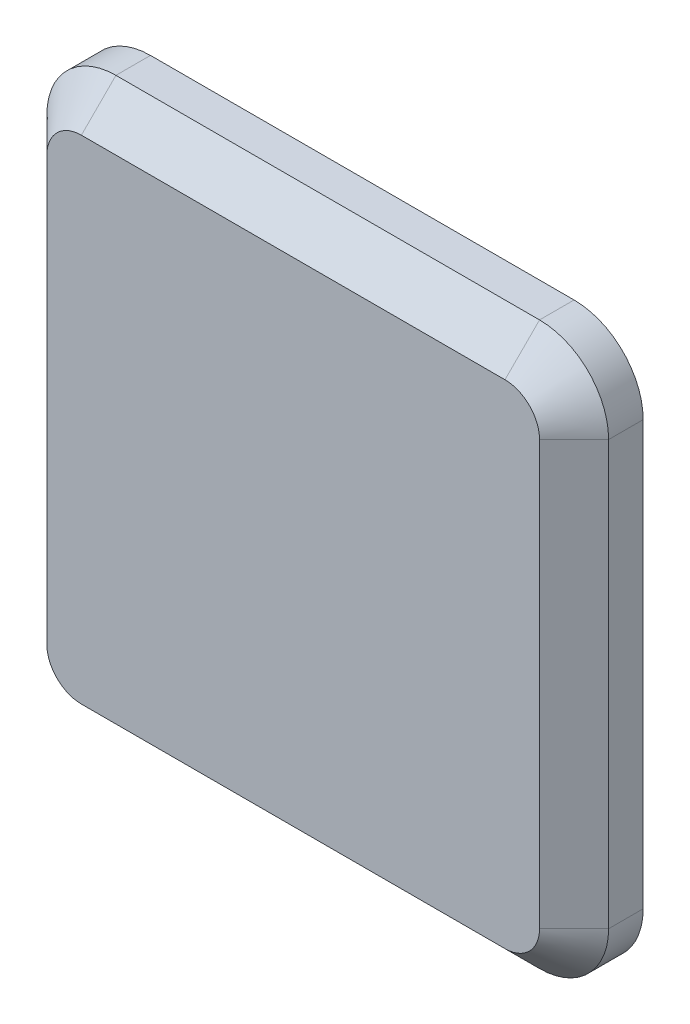
from build123d import *

# Parameters (mm, degrees)
SKETCH1_W           = 32.526911934
SKETCH1_H           = 32.526911934
BOSS_EXTRUDE1_DEPTH = 4
FILLET1_R           = 4
CHAMFER1_SIZE       = 2


with BuildPart() as part:
    # Sketch1 → Boss-Extrude1 (new body)
    with BuildSketch(Plane.XY):
        Rectangle(SKETCH1_W, SKETCH1_H)
    extrude(amount=BOSS_EXTRUDE1_DEPTH)

    # Fillet1
    fillet1_edges = [part.edges().sort_by_distance(p)[0] for p in [
        (-16.263455967, -16.263455967, 2),
        (16.263455967, -16.263455967, 2),
        (16.263455967, 16.263455967, 2),
        (-16.263455967, 16.263455967, 2),
    ]]
    fillet(fillet1_edges, radius=FILLET1_R)

    # Chamfer1
    chamfer1_edges = [part.edges().sort_by_distance(p)[0] for p in [
        (0, -16.263455967, 4),
        (15.091883092, -15.091883092, 4),
        (-15.091883092, -15.091883092, 4),
        (16.263455967, 0, 4),
        (-16.263455967, 0, 4),
        (15.091883092, 15.091883092, 4),
        (-15.091883092, 15.091883092, 4),
        (0, 16.263455967, 4),
    ]]
    chamfer(chamfer1_edges, length=CHAMFER1_SIZE)


solid = part.part
